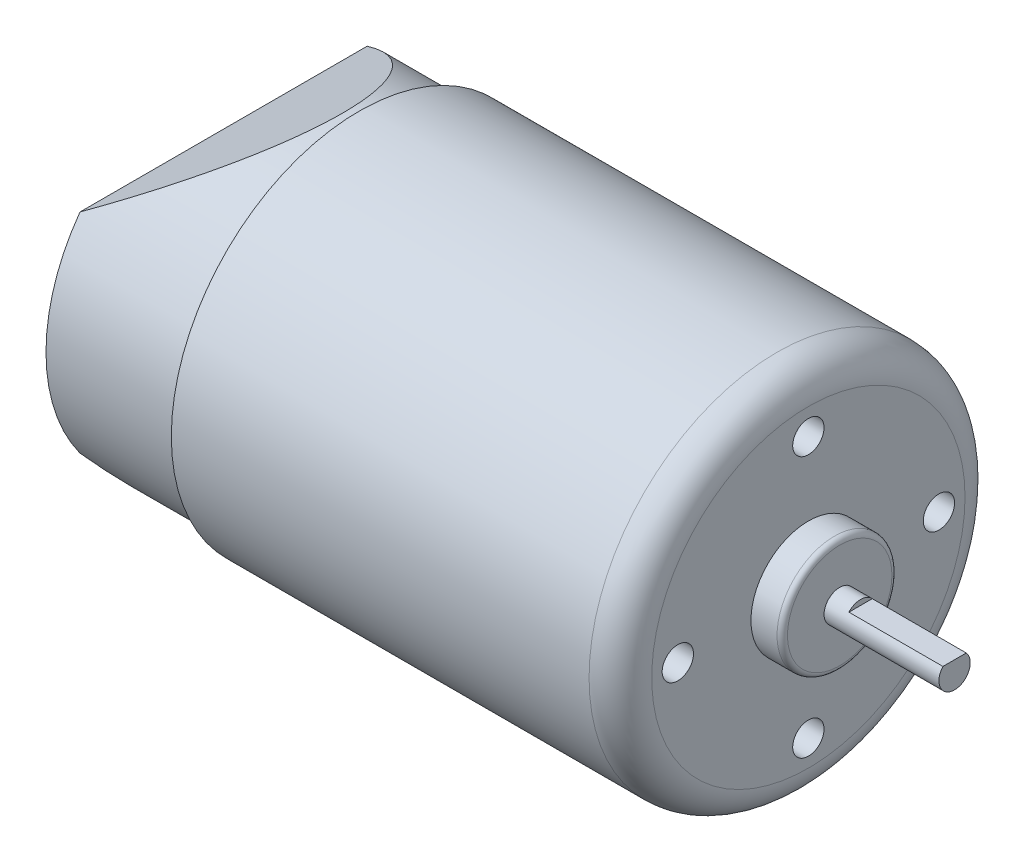
from build123d import *

# Parameters (mm, degrees)
SKETCH1_R                           = 18
BOSS_EXTRUDE1_DEPTH                 = 56
FILLET1_R                           = 3
CUT_EXTRUDE1_REACH                  = 63.514
CUT_EXTRUDE1_END_RADIUS             = 18
CUT_EXTRUDE1_DIRECTION_2_REACH      = 63.514
CUT_EXTRUDE1_DIRECTION_2_END_RADIUS = 18
SKETCH3_W                           = 13
SKETCH3_H                           = 1
SKETCH4_R                           = 5.5
BOSS_EXTRUDE2_DEPTH                 = 3
FILLET2_R                           = 0.5
SKETCH5_R                           = 1.5
BOSS_EXTRUDE3_DEPTH                 = 11
CUT_EXTRUDE2_REACH                  = 76.485
CUT_EXTRUDE2_END_RADIUS             = 1.5
SKETCH6_W                           = 9
SKETCH6_H                           = 0.5
CUT_EXTRUDE2_DIRECTION_2_REACH      = 76.485
CUT_EXTRUDE2_DIRECTION_2_END_RADIUS = 1.5
SKETCH7_R                           = 1.5
CUT_EXTRUDE3_DEPTH                  = 3


with BuildPart() as part:
    # Sketch1 → Boss-Extrude1 (new body)
    with BuildSketch(Plane(origin=(0, 0, 0), x_dir=(0, 0, -1), z_dir=(1, 0, 0))):
        Circle(SKETCH1_R)
    extrude(amount=BOSS_EXTRUDE1_DEPTH)

    # Fillet1
    fillet1_edges = [part.edges().sort_by_distance(p)[0] for p in [
        (56, 0, 18),
    ]]
    fillet(fillet1_edges, radius=FILLET1_R)

    # Cut-Extrude1: up to this cylinder (the profile starts inside it)
    cut_extrude1_end = Plane(origin=(6.282087, 0, 0), z_dir=(-1, 0, 0)) * Cylinder(CUT_EXTRUDE1_END_RADIUS, 164.028, mode=Mode.PRIVATE)
    # Sketch2 → Cut-Extrude1 (cut, up to the surface)
    with BuildSketch(Plane.XY, mode=Mode.PRIVATE) as cut_extrude1_sk1:
        Polygon((13, 18), (0, 10), (0, -10), (13, -18), (0, -18), (-7.803780753, 17.225837115), (0, 18), align=None)
    cut_extrude1_tool1 = extrude(cut_extrude1_sk1.sketch, amount=-CUT_EXTRUDE1_REACH, mode=Mode.PRIVATE) & cut_extrude1_end
    add(cut_extrude1_tool1.solids().sort_by_distance((6.282087, 14.354109, 0))[0], mode=Mode.SUBTRACT)

    # Cut-Extrude1 direction 2: up to this cylinder (the profile starts inside it)
    cut_extrude1_direction_2_end = Plane(origin=(6.282087, 0, 0), z_dir=(-1, 0, 0)) * Cylinder(CUT_EXTRUDE1_DIRECTION_2_END_RADIUS, 164.028, mode=Mode.PRIVATE)
    # Sketch2 → Cut-Extrude1 direction 2 (cut, up to the surface)
    with BuildSketch(Plane.XY, mode=Mode.PRIVATE) as cut_extrude1_direction_2_sk1:
        Polygon((13, 18), (0, 10), (0, -10), (13, -18), (0, -18), (-7.803780753, 17.225837115), (0, 18), align=None)
    cut_extrude1_direction_2_tool1 = extrude(cut_extrude1_direction_2_sk1.sketch, amount=CUT_EXTRUDE1_DIRECTION_2_REACH, mode=Mode.PRIVATE) & cut_extrude1_direction_2_end
    add(cut_extrude1_direction_2_tool1.solids().sort_by_distance((6.282087, 14.354109, 0))[0], mode=Mode.SUBTRACT)

    # Sketch3 → Cut-Revolve1 (revolve, cut)
    with BuildSketch(Plane.XY):
        with Locations((6.5, 17.5)):
            Rectangle(SKETCH3_W, SKETCH3_H)
    revolve(axis=Axis((-1000, 0, 0), (1, 0, 0)), mode=Mode.SUBTRACT)

    # Sketch4 → Boss-Extrude2 (add)
    with BuildSketch(Plane(origin=(56, 0, 0), x_dir=(0, 0, -1), z_dir=(1, 0, 0))):
        Circle(SKETCH4_R)
    extrude(amount=BOSS_EXTRUDE2_DEPTH)

    # Fillet2
    fillet2_edges = [part.edges().sort_by_distance(p)[0] for p in [
        (59, 0, 5.5),
    ]]
    fillet(fillet2_edges, radius=FILLET2_R)

    # Sketch5 → Boss-Extrude3 (add)
    with BuildSketch(Plane(origin=(59, 0, 0), x_dir=(0, 0, -1), z_dir=(1, 0, 0))):
        Circle(SKETCH5_R)
    extrude(amount=BOSS_EXTRUDE3_DEPTH)

    # Cut-Extrude2: up to this cylinder (the profile starts inside it)
    cut_extrude2_end = Plane(origin=(65.5, 0, 0), z_dir=(-1, 0, 0)) * Cylinder(CUT_EXTRUDE2_END_RADIUS, 156.97, mode=Mode.PRIVATE)
    # Sketch6 → Cut-Extrude2 (cut, up to the surface)
    with BuildSketch(Plane.XY, mode=Mode.PRIVATE) as cut_extrude2_sk1:
        with Locations((65.5, 1.25)):
            Rectangle(SKETCH6_W, SKETCH6_H)
    cut_extrude2_tool1 = extrude(cut_extrude2_sk1.sketch, amount=-CUT_EXTRUDE2_REACH, mode=Mode.PRIVATE) & cut_extrude2_end
    add(cut_extrude2_tool1.solids().sort_by_distance((65.5, 1.25, 0))[0], mode=Mode.SUBTRACT)

    # Cut-Extrude2 direction 2: up to this cylinder (the profile starts inside it)
    cut_extrude2_direction_2_end = Plane(origin=(65.5, 0, 0), z_dir=(-1, 0, 0)) * Cylinder(CUT_EXTRUDE2_DIRECTION_2_END_RADIUS, 156.97, mode=Mode.PRIVATE)
    # Sketch6 → Cut-Extrude2 direction 2 (cut, up to the surface)
    with BuildSketch(Plane.XY, mode=Mode.PRIVATE) as cut_extrude2_direction_2_sk1:
        with Locations((65.5, 1.25)):
            Rectangle(SKETCH6_W, SKETCH6_H)
    cut_extrude2_direction_2_tool1 = extrude(cut_extrude2_direction_2_sk1.sketch, amount=CUT_EXTRUDE2_DIRECTION_2_REACH, mode=Mode.PRIVATE) & cut_extrude2_direction_2_end
    add(cut_extrude2_direction_2_tool1.solids().sort_by_distance((65.5, 1.25, 0))[0], mode=Mode.SUBTRACT)

    # Sketch7 → Cut-Extrude3 (cut)
    with BuildSketch(Plane(origin=(56, 0, 0), x_dir=(0, 0, -1), z_dir=(1, 0, 0))):
        with Locations((0, 12.5)):
            Circle(SKETCH7_R)
        with Locations((12.5, 0)):
            Circle(SKETCH7_R)
        with Locations((0, -12.5)):
            Circle(SKETCH7_R)
        with Locations((-12.5, 0)):
            Circle(SKETCH7_R)
    extrude(amount=-CUT_EXTRUDE3_DEPTH, mode=Mode.SUBTRACT)


solid = part.part
